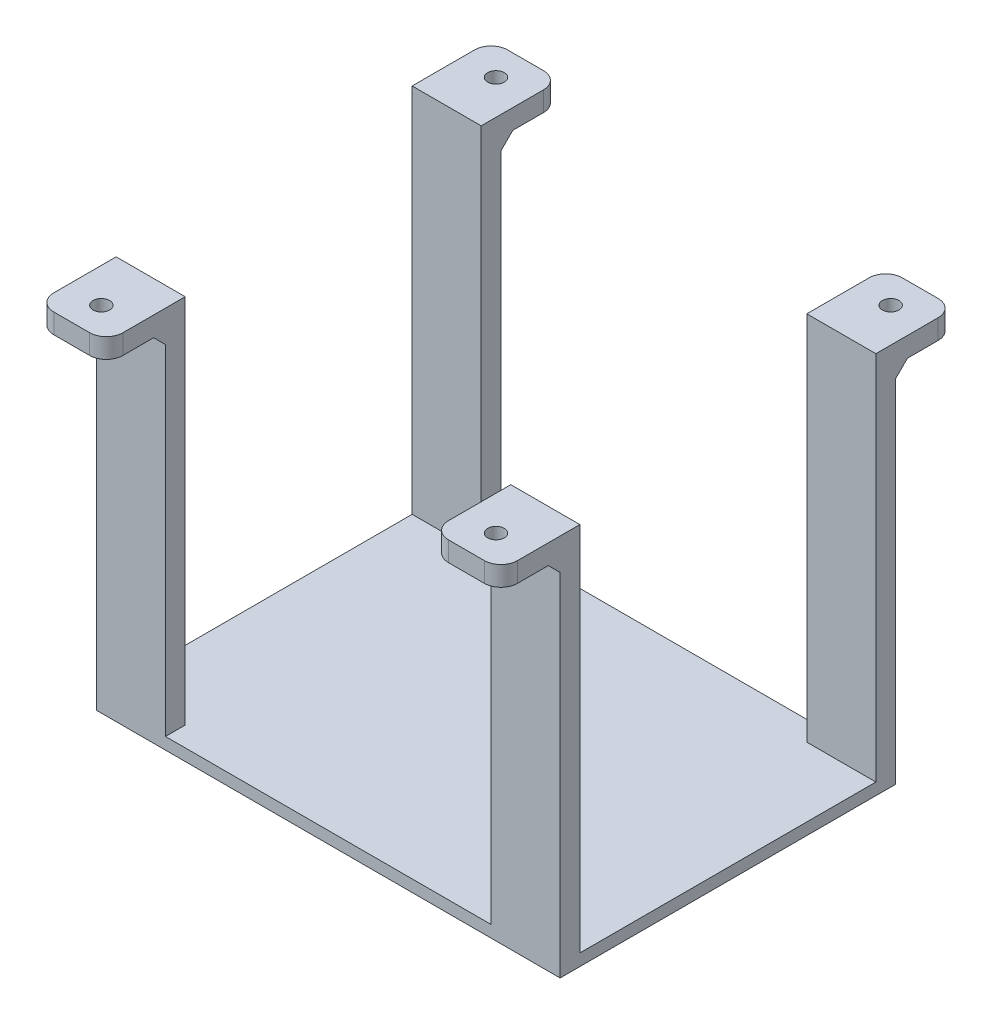
from build123d import *

# Parameters (mm, degrees)
SKETCH1_W           = 117.5
SKETCH1_H           = 85
BOSS_EXTRUDE1_DEPTH = 3
SKETCH2_W           = 17.5
SKETCH2_H           = 5
BOSS_EXTRUDE2_DEPTH = 94
SKETCH3_W           = 17.5
SKETCH3_H           = 20
SKETCH3_R           = 2.1
BOSS_EXTRUDE3_DEPTH = 5
CHAMFER1_SIZE       = 2
CHAMFER2_SIZE       = 3
FILLET1_R           = 4.2


with BuildPart() as part:
    # Sketch1 → Boss-Extrude1 (new body)
    with BuildSketch(Plane(origin=(0, 0, 0), x_dir=(1, 0, 0), z_dir=(0, 1, 0))):
        Rectangle(SKETCH1_W, SKETCH1_H)
    extrude(amount=BOSS_EXTRUDE1_DEPTH)

    # Sketch2 → Boss-Extrude2 (add)
    with BuildSketch(Plane(origin=(0, 3, 0), x_dir=(1, 0, 0), z_dir=(0, 1, 0))):
        with Locations((-50, 40)):
            Rectangle(SKETCH2_W, SKETCH2_H)
        with Locations((50, 40)):
            Rectangle(SKETCH2_W, SKETCH2_H)
        with Locations((50, -40)):
            Rectangle(SKETCH2_W, SKETCH2_H)
        with Locations((-50, -40)):
            Rectangle(SKETCH2_W, SKETCH2_H)
    extrude(amount=BOSS_EXTRUDE2_DEPTH)

    # Sketch3 → Boss-Extrude3 (add)
    # profile 1 of 4: a face of its own
    with BuildSketch(Plane(origin=(0, 97, 0), x_dir=(1, 0, 0), z_dir=(0, 1, 0))):
        with Locations((-50, 47.5)):
            Rectangle(SKETCH3_W, SKETCH3_H)
        with Locations((-50, 50)):
            Circle(SKETCH3_R, mode=Mode.SUBTRACT)
    # profile 2 of 4: a face of its own
    with BuildSketch(Plane(origin=(0, 97, 0), x_dir=(1, 0, 0), z_dir=(0, 1, 0))):
        with Locations((50, 47.5)):
            Rectangle(SKETCH3_W, SKETCH3_H)
        with Locations((50, 50)):
            Circle(SKETCH3_R, mode=Mode.SUBTRACT)
    # profile 3 of 4: a face of its own
    with BuildSketch(Plane(origin=(0, 97, 0), x_dir=(1, 0, 0), z_dir=(0, 1, 0))):
        with Locations((50, -47.5)):
            Rectangle(SKETCH3_W, SKETCH3_H)
        with Locations((50, -50)):
            Circle(SKETCH3_R, mode=Mode.SUBTRACT)
    # profile 4 of 4: a face of its own
    with BuildSketch(Plane(origin=(0, 97, 0), x_dir=(1, 0, 0), z_dir=(0, 1, 0))):
        with Locations((-50, -47.5)):
            Rectangle(SKETCH3_W, SKETCH3_H)
        with Locations((-50, -50)):
            Circle(SKETCH3_R, mode=Mode.SUBTRACT)
    extrude(amount=-BOSS_EXTRUDE3_DEPTH)

    # Chamfer1
    chamfer1_edges = [part.edges().sort_by_distance(p)[0] for p in [
        (-52.1, 92, 50),
        (47.9, 92, 50),
        (47.9, 92, -50),
        (-52.1, 92, -50),
    ]]
    chamfer(chamfer1_edges, length=CHAMFER1_SIZE)

    # Chamfer2
    chamfer2_edges = [part.edges().sort_by_distance(p)[0] for p in [
        (50, 92, 42.5),
        (-50, 92, 42.5),
        (50, 92, -42.5),
        (-50, 92, -42.5),
    ]]
    chamfer(chamfer2_edges, length=CHAMFER2_SIZE)

    # Fillet1
    fillet1_edges = [part.edges().sort_by_distance(p)[0] for p in [
        (-41.25, 94.5, 57.5),
        (-58.75, 94.5, 57.5),
        (41.25, 94.5, 57.5),
        (58.75, 94.5, 57.5),
        (-58.75, 94.5, -57.5),
        (-41.25, 94.5, -57.5),
        (41.25, 94.5, -57.5),
        (58.75, 94.5, -57.5),
    ]]
    fillet(fillet1_edges, radius=FILLET1_R)


solid = part.part
